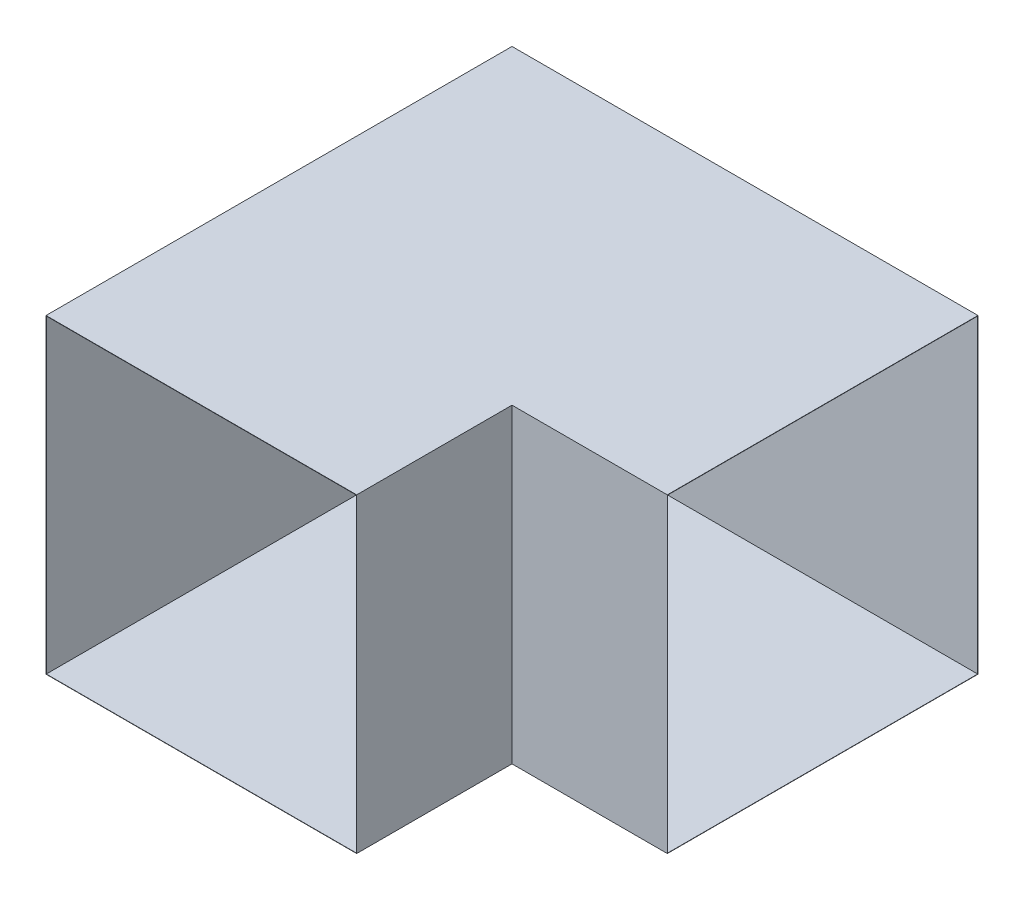
from build123d import *

# Parameters (mm, degrees)
EXTRUDE_THIN1_START       = -1000
EXTRUDE_THIN1_OUTLINE_W   = 2000
EXTRUDE_THIN1_OUTLINE_H   = 2000
EXTRUDE_THIN1_OUTLINE_W_2 = 1996
EXTRUDE_THIN1_OUTLINE_H_2 = 1996
EXTRUDE_THIN1_DEPTH       = 3000
EXTRUDE_THIN2_START       = -1998
SKETCH2_W                 = 2000
SKETCH2_H                 = 2000
SKETCH2_W_2               = 1996
SKETCH2_H_2               = 1996
EXTRUDE_THIN2_DEPTH       = 2998
CUT_EXTRUDE1_REACH        = 3743.657
SKETCH3_W                 = 1996
SKETCH3_H                 = 1996
CUT_EXTRUDE2_REACH        = 3743.657
SKETCH4_W                 = 1996
SKETCH4_H                 = 1996


# Read off the part's stored shape, not the designer's step: Extrude-Thin1
with BuildPart() as part:
    # Extrude-Thin1 outline → Extrude-Thin1 (new body)
    with BuildSketch(Plane(origin=(0, 0, 0), x_dir=(0, 0, -1), z_dir=(1, 0, 0)).offset(EXTRUDE_THIN1_START)):
        Rectangle(EXTRUDE_THIN1_OUTLINE_W, EXTRUDE_THIN1_OUTLINE_H)
        Rectangle(EXTRUDE_THIN1_OUTLINE_W_2, EXTRUDE_THIN1_OUTLINE_H_2, mode=Mode.SUBTRACT)
    extrude(amount=EXTRUDE_THIN1_DEPTH)

    # Sketch2 → Extrude-Thin2 (add)
    with BuildSketch(Plane(origin=(0, 0, 1000), x_dir=(-1, 0, 0), z_dir=(0, 0, 1)).offset(EXTRUDE_THIN2_START)):
        Rectangle(SKETCH2_W, SKETCH2_H)
        Rectangle(SKETCH2_W_2, SKETCH2_H_2, mode=Mode.SUBTRACT)
    extrude(amount=EXTRUDE_THIN2_DEPTH)

    # Sketch3 → Cut-Extrude1 (cut, up to next)
    with BuildSketch(Plane(origin=(0, 0, 2000), x_dir=(-1, 0, 0), z_dir=(0, 0, 1)), mode=Mode.PRIVATE) as cut_extrude1_sk1:
        Rectangle(SKETCH3_W, SKETCH3_H)
    cut_extrude1_tool1 = extrude(cut_extrude1_sk1.sketch, amount=-CUT_EXTRUDE1_REACH, mode=Mode.PRIVATE) & part.part
    add(cut_extrude1_tool1.solids().sort_by_distance((0, 0, 2000))[0], mode=Mode.SUBTRACT)

    # Sketch4 → Cut-Extrude2 (cut, up to next)
    with BuildSketch(Plane(origin=(2000, 0, 0), x_dir=(0, 0, -1), z_dir=(1, 0, 0)), mode=Mode.PRIVATE) as cut_extrude2_sk1:
        Rectangle(SKETCH4_W, SKETCH4_H)
    cut_extrude2_tool1 = extrude(cut_extrude2_sk1.sketch, amount=-CUT_EXTRUDE2_REACH, mode=Mode.PRIVATE) & part.part
    add(cut_extrude2_tool1.solids().sort_by_distance((2000, 0, 0))[0], mode=Mode.SUBTRACT)


solid = part.part
